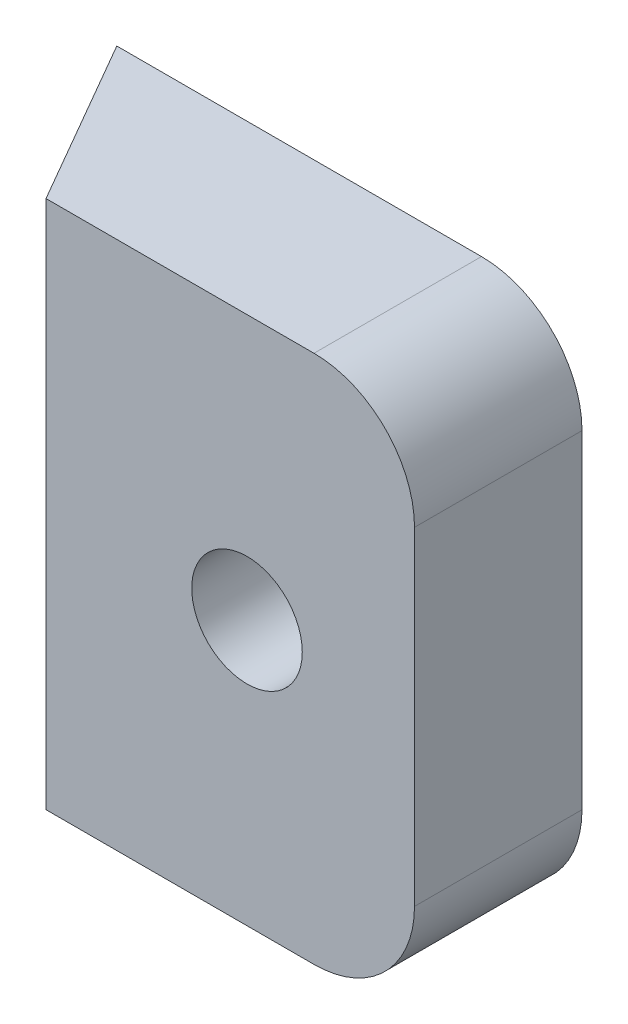
from build123d import *

# Parameters (mm, degrees)
EXTRUDE_1_DEPTH = 15.8
FILLET_1_R      = 3
M4X0_71_D       = 3.3


with BuildPart() as part:
    # Эскиз1 → Бобышка-Вытянуть1 (new body)
    with BuildSketch(Plane(origin=(0, 0, 0), x_dir=(1, 0, 0), z_dir=(0, 1, 0))):
        Polygon((0, 0), (0, 5), (-13.886751346, 5), (-11, 0), align=None)
    extrude(amount=EXTRUDE_1_DEPTH)

    # Скругление1
    fillet_1_edges = [part.edges().sort_by_distance(p)[0] for p in [
        (0, 0, -2.5),
        (0, 15.8, -2.5),
    ]]
    fillet(fillet_1_edges, radius=FILLET_1_R)

    # Отверстие обработанное метчиком M4x0.71 (through all)
    with Locations(Plane.XY):
        with Locations((-5, 7.9)):
            Hole(M4X0_71_D / 2)


solid = part.part
